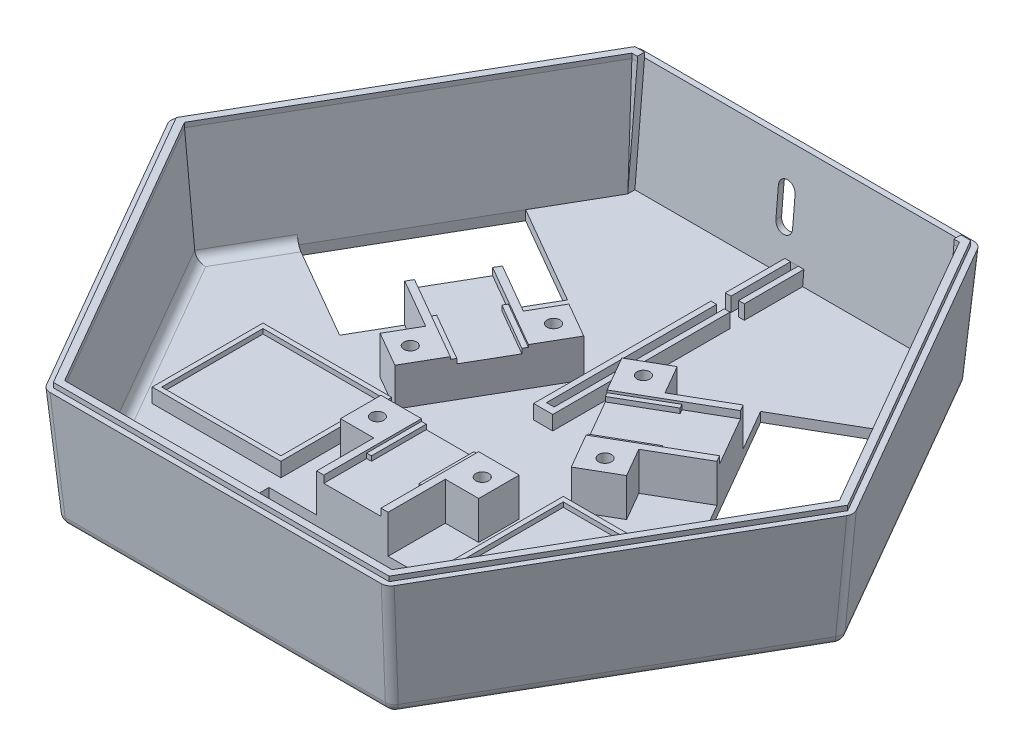
from build123d import *

# Parameters (mm, degrees)
BOSS_EXTRUDE1_DEPTH       = 25
BOSS_EXTRUDE1_DRAFT       = -5
CUT_EXTRUDE1_DEPTH        = 23
CUT_EXTRUDE1_DRAFT        = -5
SKETCH4_W                 = 35
SKETCH4_H                 = 24
CUT_EXTRUDE3_DEPTH        = 3
CUT_EXTRUDE12_DEPTH       = 17
SKETCH21_W                = 27
SKETCH21_H                = 23.25
BOSS_EXTRUDE7_DEPTH       = 3
SKETCH22_W                = 25
SKETCH22_H                = 21.25
CUT_EXTRUDE13_DEPTH       = 1
FILLET2_R                 = 2
FILLET3_R                 = 2
BOSS_EXTRUDE8_DEPTH       = 1
CUT_EXTRUDE16_DEPTH       = 1
BOSS_EXTRUDE9_DEPTH       = 8
CUT_EXTRUDE21_DEPTH       = 33.2
CUT_EXTRUDE21_DEPTH_BACK  = 33.2
BOSS_EXTRUDE10_DEPTH      = 2
BOSS_EXTRUDE10_DEPTH_BACK = 2
SKETCH38_W                = 37.2
SKETCH38_H                = 3
SKETCH40_W                = 1.61
SKETCH40_H                = 51.2
CUT_EXTRUDE23_DEPTH       = 3
SKETCH44_W                = 12
SKETCH44_H                = 20.5
CUT_EXTRUDE24_DEPTH       = 1.5
SKETCH46_W                = 1
SKETCH46_H                = 11.5
BOSS_EXTRUDE11_DEPTH      = 1
BOSS_EXTRUDE12_DEPTH      = 1
BOSS_EXTRUDE13_DEPTH      = 1
SKETCH49_R                = 1.35
CUT_EXTRUDE25_DEPTH       = 6


with BuildPart() as part:
    # Sketch1 → Boss-Extrude1 (with draft: the straight prism first)
    with BuildSketch(Plane(origin=(0, 0, 0), x_dir=(1, 0, 0), z_dir=(0, 1, 0))):
        Polygon((69.282032303, 0), (34.641016151, 60), (-34.641016151, 60), (-69.282032303, 0), (-34.641016151, -60), (34.641016151, -60), align=None)
    extrude(amount=BOSS_EXTRUDE1_DEPTH)
    # Boss-Extrude1: the draft: its side faces are tilted about the plane it starts from
    boss_extrude1_sides = [part.faces().sort_by_distance(p)[0] for p in [
        (51.961524227, 12.5, -30),
        (0, 12.5, -60),
        (-51.961524227, 12.5, -30),
        (-51.961524227, 12.5, 30),
        (0, 12.5, 60),
        (51.961524227, 12.5, 30),
    ]]
    draft(boss_extrude1_sides, Plane(origin=(0, 0, 0), x_dir=(1, 0, 0), z_dir=(0, 1, 0)), BOSS_EXTRUDE1_DRAFT)


with BuildPart() as cut_extrude1_tool:
    # Sketch2 → Cut-Extrude1 (with draft: the straight prism first)
    with BuildSketch(Plane(origin=(0, 25, 0), x_dir=(1, 0, 0), z_dir=(0, 1, 0))):
        Polygon((68.704682034, 0), (34.352341017, 59.5), (-34.352341017, 59.5), (-68.704682034, 0), (-34.352341017, -59.5), (34.352341017, -59.5), align=None)
    extrude(amount=-CUT_EXTRUDE1_DEPTH)
    # Cut-Extrude1: the draft: its side faces are tilted about the plane it starts from
    cut_extrude1_sides = [cut_extrude1_tool.faces().sort_by_distance(p)[0] for p in [
        (51.528511525, 13.5, -29.75),
        (0, 13.5, -59.5),
        (-51.528511525, 13.5, -29.75),
        (-51.528511525, 13.5, 29.75),
        (0, 13.5, 59.5),
        (51.528511525, 13.5, 29.75),
    ]]
    draft(cut_extrude1_sides, Plane(origin=(0, 25, 0), x_dir=(1, 0, 0), z_dir=(0, 1, 0)), CUT_EXTRUDE1_DRAFT)


with BuildPart() as part_1:
    add(part.part)

    # Cut-Extrude1: cut by cut_extrude1_tool
    add(cut_extrude1_tool.part, mode=Mode.SUBTRACT)

    # Sketch4 → Cut-Extrude3 (cut)
    with BuildSketch(Plane(origin=(0, 2, 0), x_dir=(1, 0, 0), z_dir=(0, 1, 0))):
        with Locations((0, -45.487760739)):
            Rectangle(SKETCH4_W, SKETCH4_H)
        Polygon((-41.035861207, 43.899324936), (-20.251251516, 31.899324936), (-37.751251516, 1.588435803), (-58.535861207, 13.588435803), align=None)
        Polygon((58.535861207, 13.588435803), (37.751251516, 1.588435803), (20.251251516, 31.899324936), (41.035861207, 43.899324936), align=None)
    extrude(amount=-CUT_EXTRUDE3_DEPTH, mode=Mode.SUBTRACT)

    # Sketch20 → Cut-Extrude12 (cut)
    with BuildSketch(Plane.XY.offset(-50)):
        with BuildLine():
            Line((-0.875, 16.65), (-0.875, 10.65))
            ThreePointArc((-0.875, 10.65), (-2.625, 8.9), (-4.375, 10.65))
            Line((-4.375, 10.65), (-4.375, 16.65))
            ThreePointArc((-4.375, 16.65), (-2.625, 18.4), (-0.875, 16.65))
        make_face()
    extrude(amount=-CUT_EXTRUDE12_DEPTH, mode=Mode.SUBTRACT)

    # Sketch21 → Boss-Extrude7 (add)
    with BuildSketch(Plane(origin=(0, 2, 0), x_dir=(1, 0, 0), z_dir=(0, 1, 0))):
        with Locations((-31.5, -18.862760739)):
            Rectangle(SKETCH21_W, SKETCH21_H)
        with Locations((31.5, -18.862760739)):
            Rectangle(SKETCH21_W, SKETCH21_H)
    extrude(amount=BOSS_EXTRUDE7_DEPTH)

    # Sketch22 → Cut-Extrude13 (cut)
    with BuildSketch(Plane(origin=(0, 5, 0), x_dir=(1, 0, 0), z_dir=(0, 1, 0))):
        with Locations((-31.5, -18.862760739)):
            Rectangle(SKETCH22_W, SKETCH22_H)
        with Locations((31.5, -18.862760739)):
            Rectangle(SKETCH22_W, SKETCH22_H)
    extrude(amount=-CUT_EXTRUDE13_DEPTH, mode=Mode.SUBTRACT)

    # Fillet2
    # the kernel refuses this fillet: 2 mm, written as the material it adds along each edge
    with BuildSketch(Plane(origin=(30.899746203, 2, 61.455591114), x_dir=(0.07547908730517383, 0.9961946980917455, 0.043577871373829326), z_dir=(0.4999999999999996, 0, -0.8660254037844389))) as fillet2_piece_1_section:
        with BuildLine():
            CenterArc((FILLET2_R * 0.916331174017, -FILLET2_R), FILLET2_R, 90, 85)
            Line((-FILLET2_R * 0.0798635240743, -FILLET2_R * 0.912844257252), (0, 0))
            Line((0, 0), (FILLET2_R * 0.916331174017, 0))
        make_face()
    fillet2_piece_1 = extrude(amount=75.544460016, mode=Mode.PRIVATE)
    fillet2_piece_1 = split(fillet2_piece_1, bisect_by=Plane(origin=(74.358014004, -0.11305863, 14.186074077), z_dir=(-0.862729915662821, 0.08715574274765853, 0.4980973490458729)), keep=Keep.TOP, mode=Mode.PRIVATE)
    fillet2_piece_1 = split(fillet2_piece_1, bisect_by=Plane(origin=(49.464507533, -0.11305863, 57.302892063), z_dir=(0, 0.08715574274765851, -0.9961946980917455)), keep=Keep.TOP, mode=Mode.PRIVATE)
    add(fillet2_piece_1)
    with BuildSketch(Plane(origin=(-37.772230008, 2, 57.487760739), x_dir=(0, 0.9961946980917454, 0.08715574274765917), z_dir=(1, 0, 0))) as fillet2_piece_2_section:
        with BuildLine():
            CenterArc((FILLET2_R * 0.916331174017, -FILLET2_R), FILLET2_R, 90, 85)
            Line((-FILLET2_R * 0.0798635240743, -FILLET2_R * 0.912844257252), (0, 0))
            Line((0, 0), (FILLET2_R * 0.916331174017, 0))
        make_face()
    fillet2_piece_2 = extrude(amount=20.272230008, mode=Mode.PRIVATE)
    fillet2_piece_2 = split(fillet2_piece_2, bisect_by=Plane(origin=(-31.243169819, 2.348863943, 60.921807241), z_dir=(0.8627299156628211, 0.08715574274765851, -0.49809734904587266)), keep=Keep.TOP, mode=Mode.PRIVATE)
    add(fillet2_piece_2)
    with BuildSketch(Plane(origin=(-68.67197621, 2, -3.967830375), x_dir=(-0.07547908730517305, 0.9961946980917455, 0.04357787137382893), z_dir=(0.5000000000000001, 0, 0.8660254037844387))) as fillet2_piece_3_section:
        with BuildLine():
            CenterArc((FILLET2_R * 0.916331174017, -FILLET2_R), FILLET2_R, 90, 85)
            Line((-FILLET2_R * 0.0798635240743, -FILLET2_R * 0.912844257252), (0, 0))
            Line((0, 0), (FILLET2_R * 0.916331174017, 0))
        make_face()
    fillet2_piece_3 = extrude(amount=75.544460016, mode=Mode.PRIVATE)
    fillet2_piece_3 = split(fillet2_piece_3, bisect_by=Plane(origin=(-74.358014004, -0.11305863, 14.186074077), z_dir=(0.8627299156628212, 0.08715574274765853, 0.4980973490458724)), keep=Keep.TOP, mode=Mode.PRIVATE)
    fillet2_piece_3 = split(fillet2_piece_3, bisect_by=Plane(origin=(-49.464507533, -0.11305863, 57.302892063), z_dir=(0, 0.08715574274765851, -0.9961946980917455)), keep=Keep.TOP, mode=Mode.PRIVATE)
    add(fillet2_piece_3)
    with BuildSketch(Plane(origin=(68.67197621, 2, 3.967830375), x_dir=(0.0754790873051722, 0.9961946980917455, -0.04357787137382845), z_dir=(-0.5000000000000001, 0, -0.8660254037844386))) as fillet2_piece_4_section:
        with BuildLine():
            CenterArc((FILLET2_R * 0.916331174017, -FILLET2_R), FILLET2_R, 90, 85)
            Line((-FILLET2_R * 0.0798635240743, -FILLET2_R * 0.912844257252), (0, 0))
            Line((0, 0), (FILLET2_R * 0.916331174017, 0))
        make_face()
    fillet2_piece_4 = extrude(amount=20.272230008, mode=Mode.PRIVATE)
    fillet2_piece_4 = split(fillet2_piece_4, bisect_by=Plane(origin=(68.381417625, 2.348863943, -3.403524862), z_dir=(-0.8627299156628213, 0.08715574274765853, -0.4980973490458722)), keep=Keep.TOP, mode=Mode.PRIVATE)
    add(fillet2_piece_4)
    with BuildSketch(Plane(origin=(-58.535861207, 2, -13.588435803), x_dir=(-0.0754790873051676, 0.9961946980917461, -0.04357787137382575), z_dir=(-0.4999999999999998, 0, 0.8660254037844388))) as fillet2_piece_5_section:
        with BuildLine():
            CenterArc((FILLET2_R * 0.916331174017, -FILLET2_R), FILLET2_R, 90, 85)
            Line((-FILLET2_R * 0.0798635240743, -FILLET2_R * 0.912844257252), (0, 0))
            Line((0, 0), (FILLET2_R * 0.916331174017, 0))
        make_face()
    fillet2_piece_5 = extrude(amount=20.272230008, mode=Mode.PRIVATE)
    fillet2_piece_5 = split(fillet2_piece_5, bisect_by=Plane(origin=(-68.381417625, 2.348863943, -3.403524862), z_dir=(0.8627299156628211, 0.08715574274765851, -0.49809734904587266)), keep=Keep.TOP, mode=Mode.PRIVATE)
    add(fillet2_piece_5)
    with BuildSketch(Plane(origin=(17.5, 2, 57.487760739), x_dir=(0, 0.9961946980917459, 0.0871557427476554), z_dir=(1, 0, 0))) as fillet2_piece_6_section:
        with BuildLine():
            CenterArc((FILLET2_R * 0.916331174017, -FILLET2_R), FILLET2_R, 90, 85)
            Line((-FILLET2_R * 0.0798635240743, -FILLET2_R * 0.912844257252), (0, 0))
            Line((0, 0), (FILLET2_R * 0.916331174017, 0))
        make_face()
    fillet2_piece_6 = extrude(amount=20.272230008, mode=Mode.PRIVATE)
    fillet2_piece_6 = split(fillet2_piece_6, bisect_by=Plane(origin=(31.243169819, 2.348863943, 60.921807241), z_dir=(-0.8627299156628213, 0.08715574274765853, -0.4980973490458722)), keep=Keep.TOP, mode=Mode.PRIVATE)
    add(fillet2_piece_6)

    # Fillet3
    fillet3_edges = [part_1.edges().sort_by_distance(p)[0] for p in [
        (35.272411194, 12.5, 61.093608294),
        (-35.272411194, 12.5, 61.093608294),
        (-70.544822389, 12.5, 0),
        (-35.272411194, 12.5, -61.093608294),
        (35.272411194, 12.5, -61.093608294),
        (70.544822389, 12.5, 0),
        (0, 0, 60),
        (-51.961524227, 0, 30),
        (-51.961524227, 0, -30),
        (0, 0, -60),
        (51.961524227, 0, -30),
        (51.961524227, 0, 30),
    ]]
    fillet(fillet3_edges, radius=FILLET3_R)

    # Sketch24 → Boss-Extrude8 (add)
    with BuildSketch(Plane(origin=(0, 25, 0), x_dir=(1, 0, 0), z_dir=(0, 1, 0))):
        Polygon((70.436732841, 0), (35.218366421, 61), (-35.218366421, 61), (-70.436732841, 0), (-35.218366421, -61), (35.218366421, -61), align=None)
    extrude(amount=BOSS_EXTRUDE8_DEPTH)

    # Sketch25 → Cut-Extrude16 (cut)
    with BuildSketch(Plane(origin=(0, 26, 0), x_dir=(1, 0, 0), z_dir=(0, 1, 0))):
        Polygon((68.704682034, 0), (34.352341017, 59.5), (-34.352341017, 59.5), (-68.704682034, 0), (-34.352341017, -59.5), (34.352341017, -59.5), align=None)
    extrude(amount=-CUT_EXTRUDE16_DEPTH, mode=Mode.SUBTRACT)

    # Sketch26 → Boss-Extrude9 (add)
    with BuildSketch(Plane(origin=(0, 2, 0), x_dir=(1, 0, 0), z_dir=(0, 1, 0))):
        Polygon((-25.251251516, 23.239070898), (-14.85894667, 17.239070898), (-11.35894667, 23.301248724), (-3.997730738, 19.051248724), (-18.497730738, -6.063487985), (-25.85894667, -1.813487985), (-22.35894667, 4.248689841), (-32.751251516, 10.248689841), align=None)
        Polygon((25.251251516, 23.239070898), (32.751251516, 10.248689841), (22.35894667, 4.248689841), (25.85894667, -1.813487985), (18.497730738, -6.063487985), (3.997730738, 19.051248724), (11.35894667, 23.301248724), (14.85894667, 17.239070898), align=None)
        Polygon((7.5, -33.487760739), (-7.5, -33.487760739), (-7.5, -21.487760739), (-14.5, -21.487760739), (-14.5, -12.987760739), (14.5, -12.987760739), (14.5, -21.487760739), (7.5, -21.487760739), align=None)
    extrude(amount=BOSS_EXTRUDE9_DEPTH)

    # Sketch37 → Cut-Extrude21 (cut, two sides: drawn at the far end of the back side and taken through both)
    with BuildSketch(Plane(origin=(0, 0, 0), x_dir=(0, 0, -1), z_dir=(1, 0, 0)).offset(-CUT_EXTRUDE21_DEPTH_BACK)):
        Polygon((57.487760739, 2), (58.97764872, 2), (61, 25), (61.395251017, 29.49515051), (58.593510601, 29.741502828), (55.577582395, 2), align=None)
    extrude(amount=CUT_EXTRUDE21_DEPTH + CUT_EXTRUDE21_DEPTH_BACK, mode=Mode.SUBTRACT)

    # Sketch38 → Boss-Extrude10 (add, two sides: drawn at the far end of the back side and taken through both)
    with BuildSketch(Plane(origin=(0, 0, 0), x_dir=(0, 0, -1), z_dir=(1, 0, 0)).offset(-BOSS_EXTRUDE10_DEPTH_BACK)):
        Polygon((58.97764872, 2), (59.241433669, 5), (46.741433669, 5), (46.741433669, 2), align=None)
        with Locations((25.141433669, 3.5)):
            Rectangle(SKETCH38_W, SKETCH38_H)
    extrude(amount=BOSS_EXTRUDE10_DEPTH + BOSS_EXTRUDE10_DEPTH_BACK)

    # Sketch40 → Cut-Extrude23 (cut)
    with BuildSketch(Plane(origin=(0, 5, 0), x_dir=(1, 0, 0), z_dir=(0, 1, 0))):
        with Locations((0, 33.641433669)):
            Rectangle(SKETCH40_W, SKETCH40_H)
    extrude(amount=-CUT_EXTRUDE23_DEPTH, mode=Mode.SUBTRACT)

    # Sketch44 → Cut-Extrude24 (cut)
    with BuildSketch(Plane(origin=(0, 10, 0), x_dir=(1, 0, 0), z_dir=(0, 1, 0))):
        with Locations((0, -23.237760739)):
            Rectangle(SKETCH44_W, SKETCH44_H)
        Polygon((-26.001251516, 21.940032792), (-8.247730738, 11.690032792), (-14.247730738, 1.297727947), (-32.001251516, 11.547727947), align=None)
        Polygon((32.001251516, 11.547727947), (14.247730738, 1.297727947), (8.247730738, 11.690032792), (26.001251516, 21.940032792), align=None)
    extrude(amount=-CUT_EXTRUDE24_DEPTH, mode=Mode.SUBTRACT)

    # Sketch46 → Boss-Extrude11 (add)
    with BuildSketch(Plane(origin=(0, 8.5, 0), x_dir=(1, 0, 0), z_dir=(0, 1, 0))):
        with Locations((-5.5, -18.737760739)):
            Rectangle(SKETCH46_W, SKETCH46_H)
        with Locations((5.5, -18.737760739)):
            Rectangle(SKETCH46_W, SKETCH46_H)
    extrude(amount=BOSS_EXTRUDE11_DEPTH)

    # Sketch47 → Boss-Extrude12 (add)
    with BuildSketch(Plane(origin=(0, 8.5, 0), x_dir=(1, 0, 0), z_dir=(0, 1, 0))):
        Polygon((-14.247730738, 1.297727947), (-13.747730738, 2.163753351), (-23.707022882, 7.913753351), (-24.207022882, 7.047727947), align=None)
        Polygon((-8.247730738, 11.690032792), (-8.747730738, 10.824007388), (-18.707022882, 16.574007388), (-18.207022882, 17.440032792), align=None)
    extrude(amount=BOSS_EXTRUDE12_DEPTH)

    # Sketch48 → Boss-Extrude13 (add)
    with BuildSketch(Plane(origin=(0, 8.5, 0), x_dir=(1, 0, 0), z_dir=(0, 1, 0))):
        Polygon((14.247730738, 1.297727947), (13.747730738, 2.163753351), (23.707022882, 7.913753351), (24.207022882, 7.047727947), align=None)
        Polygon((8.247730738, 11.690032792), (8.747730738, 10.824007388), (18.707022882, 16.574007388), (18.207022882, 17.440032792), align=None)
    extrude(amount=BOSS_EXTRUDE13_DEPTH)

    # Sketch49 → Cut-Extrude25 (cut)
    with BuildSketch(Plane(origin=(0, 10, 0), x_dir=(1, 0, 0), z_dir=(0, 1, 0))):
        with Locations(Location((-20.428338704, -0.907399072, 0), (0, 0, 270))):
            Circle(SKETCH49_R)
        with Locations(Location((-9.428338704, 18.145159811, 0), (0, 0, 270))):
            Circle(SKETCH49_R)
        with Locations(Location((9.428338704, 18.145159811, 0), (0, 0, 270))):
            Circle(SKETCH49_R)
        with Locations(Location((20.428338704, -0.907399072, 0), (0, 0, 270))):
            Circle(SKETCH49_R)
        with Locations(Location((11, -17.237760739, 0), (0, 0, 270))):
            Circle(SKETCH49_R)
        with Locations(Location((-11, -17.237760739, 0), (0, 0, 270))):
            Circle(SKETCH49_R)
    extrude(amount=-CUT_EXTRUDE25_DEPTH, mode=Mode.SUBTRACT)


solid = part_1.part
